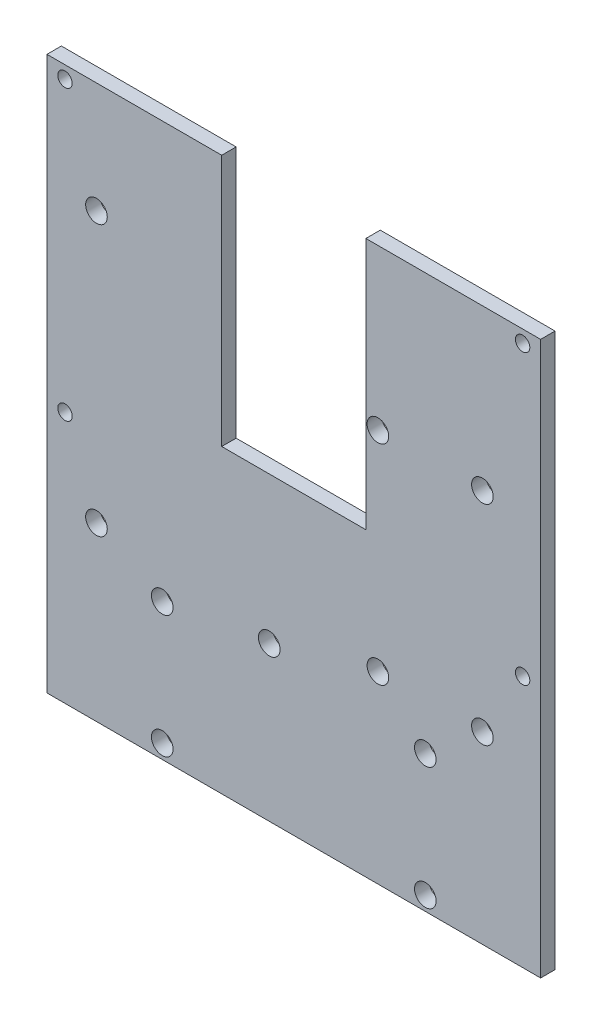
from build123d import *

# Parameters (mm, degrees)
SKETCH_1_R          = 2
EXTRUDE_1_DEPTH     = 4
SKETCH_2_R          = 2
CUT_EXTRUDE_1_DEPTH = 26
EXTRUDE_3_DEPTH     = 4
FILLET_1_R          = 4
FILLET_2_R          = 4
SKETCH_5_W          = 10
SKETCH_5_H          = 14
EXTRUDE_4_DEPTH     = 4
FILLET_3_R          = 4
FILLET_1_2_DEPTH    = 4
CUT_EXTRUDE_2_DEPTH = 10
SKETCH_7_R          = 3
CUT_EXTRUDE_3_DEPTH = 10
CUT_EXTRUDE_4_DEPTH = 10
SKETCH_9_W          = 20
SKETCH_9_H          = 70
SKETCH_9_R          = 3
CUT_EXTRUDE_5_DEPTH = 10
CUT_EXTRUDE_6_DEPTH = 10


with BuildPart() as part:
    # 草图1 → 凸台-拉伸1 (new body)
    with BuildSketch(Plane.XY):
        with BuildLine():
            Line((0, -30), (0, 87))
            Line((0, 87), (-8, 87))
            Line((-8, 87), (-8, 95))
            Line((-8, 95), (0, 95))
            Line((0, 95), (0, 155))
            Line((0, 155), (-20, 155))
            Line((-20, 155), (-20, 180))
            Line((-20, 180), (-8, 180))
            ThreePointArc((-8, 180), (-0.928932188, 182.928932188), (2, 190))
            Line((2, 190), (2, 212))
            Line((2, 212), (10, 212))
            Line((10, 212), (10, 190))
            ThreePointArc((10, 190), (12.928932188, 182.928932188), (20, 180))
            Line((20, 180), (72.5, 180))
            Line((72.5, 180), (125, 180))
            ThreePointArc((125, 180), (132.071067812, 182.928932188), (135, 190))
            Line((135, 190), (135, 212))
            Line((135, 212), (143, 212))
            Line((143, 212), (143, 190))
            ThreePointArc((143, 190), (145.928932188, 182.928932188), (153, 180))
            Line((153, 180), (165, 180))
            Line((165, 180), (165, 155))
            Line((165, 155), (145, 155))
            Line((145, 155), (145, 95))
            Line((145, 95), (153, 95))
            Line((153, 95), (153, 87))
            Line((153, 87), (145, 87))
            Line((145, 87), (145, -30))
            Line((145, -30), (0, -30))
        make_face()
        with Locations((139, 208)):
            Circle(SKETCH_1_R, mode=Mode.SUBTRACT)
        with Locations(Location((149, 91, 0), (0, 0, 180))):
            Circle(SKETCH_1_R, mode=Mode.SUBTRACT)
        with Locations(Location((9, 40, 0), (0, 0, 180))):
            Circle(SKETCH_1_R, mode=Mode.SUBTRACT)
        with Locations(Location((9, 120, 0), (0, 0, 180))):
            Circle(SKETCH_1_R, mode=Mode.SUBTRACT)
        with Locations((-4, 91)):
            Circle(SKETCH_1_R, mode=Mode.SUBTRACT)
        with Locations(Location((6, 208, 0), (0, 0, 180))):
            Circle(SKETCH_1_R, mode=Mode.SUBTRACT)
        with Locations((136, 120)):
            Circle(SKETCH_1_R, mode=Mode.SUBTRACT)
        with Locations((136, 40)):
            Circle(SKETCH_1_R, mode=Mode.SUBTRACT)
    extrude(amount=EXTRUDE_1_DEPTH)

    # 草图2 → 切除-拉伸1 (cut)
    with BuildSketch(Plane(origin=(0, 0, 0), x_dir=(-1, 0, 0), z_dir=(0, 0, -1))):
        with Locations((-90.5, 176)):
            Circle(SKETCH_2_R)
        with Locations((-82.5, 176)):
            Circle(SKETCH_2_R)
        with Locations((-62.5, 176)):
            Circle(SKETCH_2_R)
        with Locations((-54.5, 176)):
            Circle(SKETCH_2_R)
    extrude(amount=-CUT_EXTRUDE_1_DEPTH, mode=Mode.SUBTRACT)

    # 草图4 → 凸台-拉伸3 (add)
    with BuildSketch(Plane(origin=(0, 0, 0), x_dir=(-1, 0, 0), z_dir=(0, 0, -1))):
        with BuildLine():
            Line((-102.5, 194), (-102.5, 204.972470671))
            Line((-102.5, 204.972470671), (-99, 215.944941341))
            Line((-99, 215.944941341), (-95.5, 215.944941341))
            ThreePointArc((-95.5, 215.944941341), (-92.121980777, 211.957020041), (-89.03099134, 207.742721229))
            ThreePointArc((-89.03099134, 207.742721229), (-72.5, 199), (-55.96900866, 207.742721229))
            ThreePointArc((-55.96900866, 207.742721229), (-52.878019223, 211.957020041), (-49.5, 215.944941341))
            Line((-49.5, 215.944941341), (-46, 215.944941341))
            Line((-46, 215.944941341), (-42.5, 204.972470671))
            Line((-42.5, 204.972470671), (-42.5, 194))
            Line((-42.5, 194), (-42.5, 180))
            Line((-42.5, 180), (-49.5, 180))
            Line((-49.5, 180), (-49.5, 194))
            Line((-49.5, 194), (-95.5, 194))
            Line((-95.5, 194), (-95.5, 180))
            Line((-95.5, 180), (-102.5, 180))
            Line((-102.5, 180), (-102.5, 194))
        make_face()
    extrude(amount=-EXTRUDE_3_DEPTH)

    # Fillet 1
    fillet_1_edges = [part.edges().sort_by_distance(p)[0] for p in [
        (102.5, 180, 2),
    ]]
    fillet(fillet_1_edges, radius=FILLET_1_R)

    # 圆角2
    fillet_2_edges = [part.edges().sort_by_distance(p)[0] for p in [
        (42.5, 180, 2),
    ]]
    fillet(fillet_2_edges, radius=FILLET_2_R)

    # 草图5 → 凸台-拉伸4 (add)
    with BuildSketch(Plane(origin=(0, 0, 0), x_dir=(-1, 0, 0), z_dir=(0, 0, -1))):
        with Locations((-71.485667886, 187)):
            Rectangle(SKETCH_5_W, SKETCH_5_H)
    extrude(amount=-EXTRUDE_4_DEPTH)

    # 圆角3
    fillet_3_edges = [part.edges().sort_by_distance(p)[0] for p in [
        (0, 95, 2),
    ]]
    fillet(fillet_3_edges, radius=FILLET_3_R)

    # Fillet 1 2: read off the stored shape, not the designer's step
    # Fillet 1 2 outline → Fillet 1 2 (add)
    with BuildSketch(Plane.XY):
        with BuildLine():
            add(Edge.make_bspline(
                [(0, 85), (0, 87), (-2, 87)],
                knots=[0, 0, 0, 1, 1, 1], degree=2, weights=[1, 0.707106781, 1]))
            Line((0, 85), (0, 87))
            Line((0, 87), (-2, 87))
        make_face()
        with BuildLine():
            add(Edge.make_bspline(
                [(145, 97), (145, 95), (147, 95)],
                knots=[0, 0, 0, 1, 1, 1], degree=2, weights=[1, 0.707106781, 1]))
            Line((145, 97), (145, 95))
            Line((145, 95), (147, 95))
        make_face()
        with BuildLine():
            add(Edge.make_bspline(
                [(147, 87), (145, 87), (145, 85)],
                knots=[0, 0, 0, 1, 1, 1], degree=2, weights=[1, 0.707106781, 1]))
            Line((147, 87), (145, 87))
            Line((145, 87), (145, 85))
        make_face()
    extrude(amount=FILLET_1_2_DEPTH)

    # 草图6 → 切除-拉伸2 (cut)
    with BuildSketch(Plane(origin=(0, 0, 0), x_dir=(-1, 0, 0), z_dir=(0, 0, -1))):
        with BuildLine():
            Line((-145, 126), (0, 127))
            ThreePointArc((0, 127), (86.5779564, 788.380122484), (-240.522742442, 207.067348009))
            Line((-240.522742442, 207.067348009), (-145, 126))
        make_face()
        Polygon((-145, 97), (-145, 85), (-184.843069779, 78.009614434), (-187.688323439, 115.332647741), align=None)
        Polygon((0, 85), (0, 99), (22.414932697, 115.332647741), (70.043948421, 78.009614434), align=None)
    extrude(amount=-CUT_EXTRUDE_2_DEPTH, mode=Mode.SUBTRACT)

    # 草图7 → 切除-拉伸3 (cut)
    with BuildSketch(Plane(origin=(0, 0, 0), x_dir=(-1, 0, 0), z_dir=(0, 0, -1))):
        with Locations((-109, 7.960589548)):
            Circle(SKETCH_7_R)
        with Locations((-36, 7.960589548)):
            Circle(SKETCH_7_R)
        with Locations((-109, -26.039410452)):
            Circle(SKETCH_7_R)
        with Locations((-36, -26.039410452)):
            Circle(SKETCH_7_R)
        with Locations((-124.840103492, 79.073280951)):
            Circle(SKETCH_7_R)
        with Locations((-124.840103492, 21.073280951)):
            Circle(SKETCH_7_R)
        with Locations((-95.840103492, 21.073280951)):
            Circle(SKETCH_7_R)
        with Locations((-95.840103492, 79.073280951)):
            Circle(SKETCH_7_R)
        with Locations((-65.68273437, 95.743302343)):
            Circle(SKETCH_7_R)
        with Locations((-65.68273437, 12.743302343)):
            Circle(SKETCH_7_R)
        with Locations((-17.742400545, 17.739740347)):
            Circle(SKETCH_7_R)
        with Locations((-17.742400545, 92.739740347)):
            Circle(SKETCH_7_R)
    extrude(amount=-CUT_EXTRUDE_3_DEPTH, mode=Mode.SUBTRACT)

    # 草图8 → 切除-拉伸4 (cut)
    with BuildSketch(Plane(origin=(0, 0, 0), x_dir=(-1, 0, 0), z_dir=(0, 0, -1))):
        Polygon((-154.568758674, 123.48356313), (9.260166048, 123.48356313), (22.383573851, 133.739706362), (-120.787265427, 138.710916059), align=None)
    extrude(amount=-CUT_EXTRUDE_4_DEPTH, mode=Mode.SUBTRACT)

    # 草图9 → 切除-拉伸5 (cut)
    # profile 1 of 2: a face of its own
    with BuildSketch(Plane(origin=(0, 0, 0), x_dir=(-1, 0, 0), z_dir=(0, 0, -1))):
        with Locations((-82.5, 88.48356313)):
            Rectangle(SKETCH_9_W, SKETCH_9_H)
    # profile 2 of 2: a face of its own
    with BuildSketch(Plane(origin=(0, 0, 0), x_dir=(-1, 0, 0), z_dir=(0, 0, -1))):
        with Locations((-62.5, 88.48356313)):
            Rectangle(SKETCH_9_W, SKETCH_9_H)
        with Locations((-65.68273437, 95.743302343)):
            Circle(SKETCH_9_R, mode=Mode.SUBTRACT)
    extrude(amount=-CUT_EXTRUDE_5_DEPTH, mode=Mode.SUBTRACT)

    # 草图10 → 切除-拉伸6 (cut)
    with BuildSketch(Plane(origin=(0, 0, 0), x_dir=(-1, 0, 0), z_dir=(0, 0, -1))):
        Polygon((-141.001388933, 153.448037881), (-141.001388933, -56.355097375), (-194.104207941, 53.872664694), align=None)
        Polygon((-4, 153.448037881), (-4, -50.760982065), (2.911690677, -47.431237796), (83.451298672, 119.6813615), align=None)
    extrude(amount=-CUT_EXTRUDE_6_DEPTH, mode=Mode.SUBTRACT)


solid = part.part
